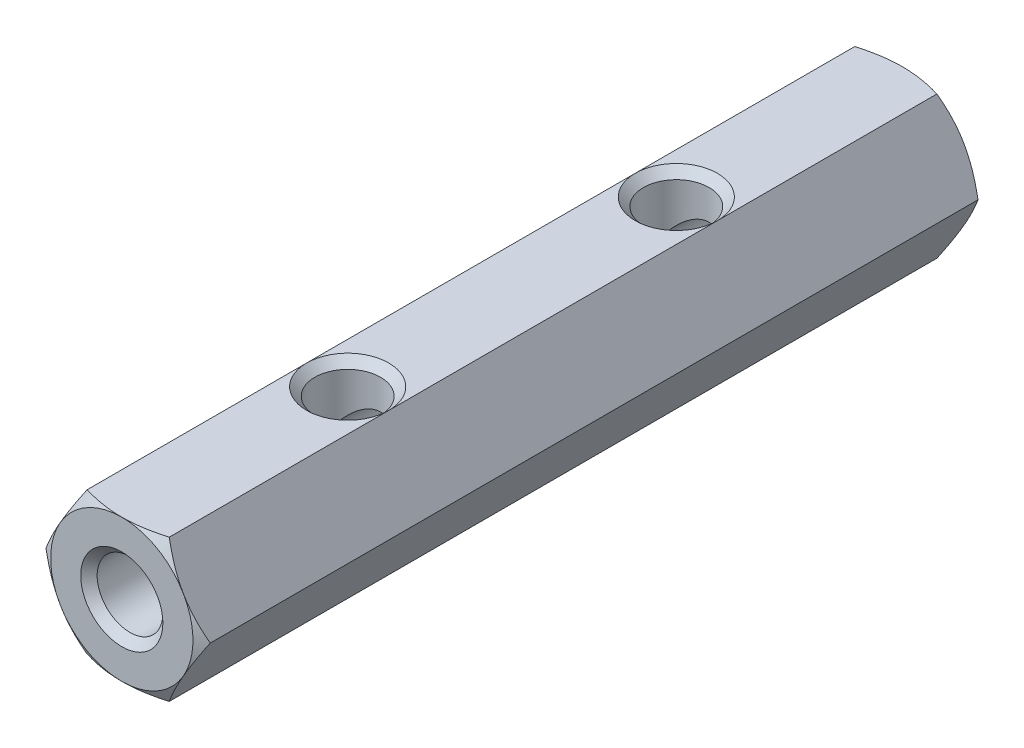
from build123d import *

# Parameters (mm, degrees)
EXTRUDE_1_DEPTH          = 9.5
SKETCH_2_OUTSIDE_W       = 79.862
SKETCH_2_OUTSIDE_H       = 79.326
SKETCH_2_OUTSIDE_R       = 1.732050808
CUT_EXTRUDE_1_DEPTH      = 20.183326093
CUT_EXTRUDE_1_DRAFT      = -60
HOLE_WIZARD_M2_1_D       = 1.6
HOLE_WIZARD_M2_2_D       = 1.6
MIRROR_1_COPY_1_SKETCH_W = 79.862
MIRROR_1_COPY_1_SKETCH_H = 79.326
MIRROR_1_COPY_1_SKETCH_R = 1.732050808
MIRROR_1_COPY_1_DEPTH    = 20.183326093
MIRROR_1_COPY_1_DRAFT    = -60
CHAMFER_1_SIZE           = 0.2


with BuildPart() as part:
    # 草图1 → 凸台-拉伸1 (new, symmetric)
    with BuildSketch(Plane.XY):
        Polygon((2, 0), (1, 1.732050808), (-1, 1.732050808), (-2, 0), (-1, -1.732050808), (1, -1.732050808), align=None)
    extrude(amount=EXTRUDE_1_DEPTH, both=True)


with BuildPart() as cut_extrude_1_tool:
    # 草图2 outside → 切除-拉伸1 (with draft: the straight prism first)
    with BuildSketch(Plane.XY.offset(9.5)):
        Rectangle(SKETCH_2_OUTSIDE_W, SKETCH_2_OUTSIDE_H)
        Circle(SKETCH_2_OUTSIDE_R, mode=Mode.SUBTRACT)
    extrude(amount=-CUT_EXTRUDE_1_DEPTH)
    # 切除-拉伸1: the draft: its side faces are tilted about the plane it starts from
    cut_extrude_1_sides = [cut_extrude_1_tool.faces().sort_by_distance(p)[0] for p in [
        (0, -39.663, -0.591663047),
        (39.931, 0, -0.591663047),
        (0, 39.663, -0.591663047),
        (-39.931, 0, -0.591663047),
        (-1.732050808, 0, -0.591663047),
    ]]
    draft(cut_extrude_1_sides, Plane.XY.offset(9.5), CUT_EXTRUDE_1_DRAFT)


with BuildPart() as part_1:
    add(part.part)

    # 切除-拉伸1: cut by cut_extrude_1_tool
    add(cut_extrude_1_tool.part, mode=Mode.SUBTRACT)

    # M2 螺纹孔1 (through all)
    with Locations(Plane.XY.offset(9.5)):
        with Locations((0, 0)):
            hole_wizard_m2_1 = Hole(HOLE_WIZARD_M2_1_D / 2)

    # M2 螺纹孔2 (through all)
    with Locations(Plane(origin=(0, 1.732050808, 0), x_dir=(1, 0, 0), z_dir=(0, 1, 0))):
        with Locations((0, -4)):
            hole_wizard_m2_2 = Hole(HOLE_WIZARD_M2_2_D / 2)

    # 镜向1: M2 螺纹孔1, M2 螺纹孔2 across plane
    add(hole_wizard_m2_1.mirror(Plane.XY), mode=Mode.SUBTRACT)
    add(hole_wizard_m2_2.mirror(Plane.XY), mode=Mode.SUBTRACT)


with BuildPart() as mirror_1_copy_1_tool:
    # 镜向1 copy 1 sketch → 镜向1 copy 1 (with draft: the straight prism first)
    with BuildSketch(Plane(origin=(0, 0, -9.5), x_dir=(1, 0, 0), z_dir=(0, 0, -1))):
        Rectangle(MIRROR_1_COPY_1_SKETCH_W, MIRROR_1_COPY_1_SKETCH_H)
        Circle(MIRROR_1_COPY_1_SKETCH_R, mode=Mode.SUBTRACT)
    extrude(amount=-MIRROR_1_COPY_1_DEPTH)
    # 镜向1 copy 1: the draft: its side faces are tilted about the plane it starts from
    mirror_1_copy_1_sides = [mirror_1_copy_1_tool.faces().sort_by_distance(p)[0] for p in [
        (0, -39.663, 0.591663047),
        (39.931, 0, 0.591663047),
        (0, 39.663, 0.591663047),
        (-39.931, 0, 0.591663047),
        (-1.732050808, 0, 0.591663047),
    ]]
    draft(mirror_1_copy_1_sides, Plane(origin=(0, 0, -9.5), x_dir=(1, 0, 0), z_dir=(0, 0, -1)), MIRROR_1_COPY_1_DRAFT)


with BuildPart() as part_2:
    add(part_1.part)

    # 镜向1 copy 1: cut by mirror_1_copy_1_tool
    add(mirror_1_copy_1_tool.part, mode=Mode.SUBTRACT)

    # 倒角1
    chamfer_1_edges = [part_2.edges().sort_by_distance(p)[0] for p in [
        (0.8, -1.732050808, -4),
        (0.8, 1.732050808, -4),
        (0.8, 0, 9.5),
        (0.8, 0, -9.5),
        (0.8, -1.732050808, 4),
        (0.8, 1.732050808, 4),
    ]]
    chamfer(chamfer_1_edges, length=CHAMFER_1_SIZE - 0.0001)  # a hair under: the kernel refuses the full size


solid = part_2.part
